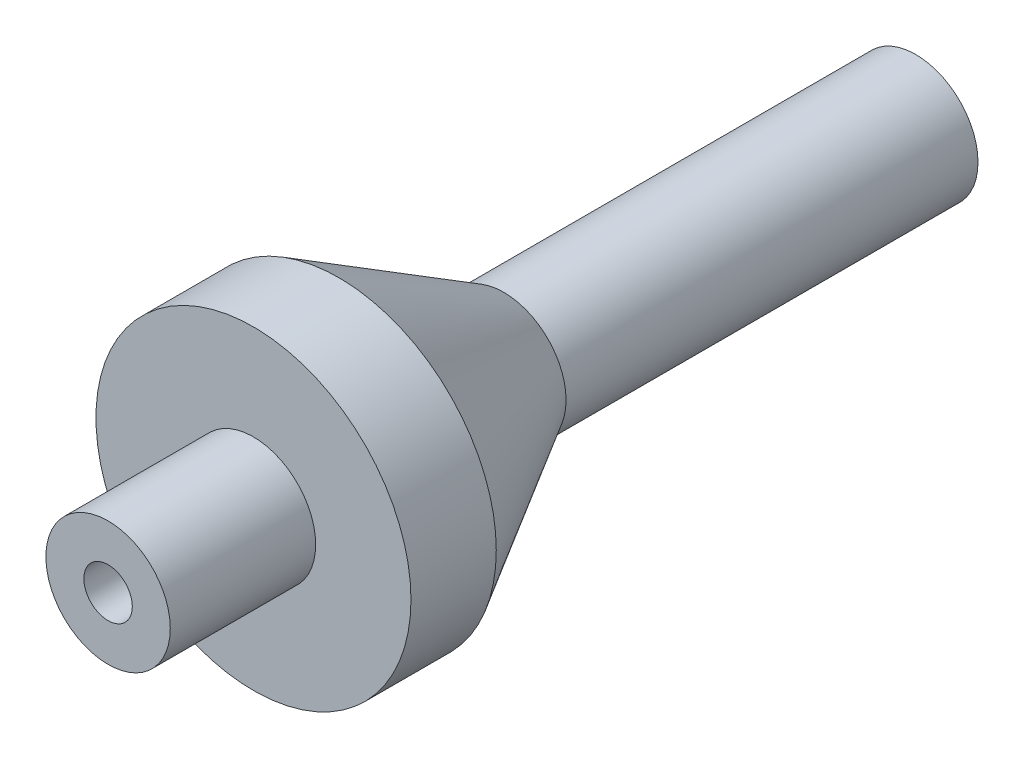
from build123d import *

# Parameters (mm, degrees)
CHAMFER1_SIZE   = 6.062177826
CHAMFER1_SIZE_2 = 10.5


with BuildPart() as part:
    # Sketch2 → Revolve1 (revolve)
    with BuildSketch(Plane(origin=(0, 0, 0), x_dir=(1, 0, 0), z_dir=(0, 1, 0))):
        Polygon((1.5, 0), (3.85, 0), (3.85, 9), (9.75, 9), (9.75, 14), (3.85, 14), (3.85, 50), (1.5, 50), align=None)
    revolve(axis=Axis((0, 0, 0), (0, 0, -1)))

    # Chamfer1
    # the kernel refuses this chamfer: 10.5, 6.062177826 mm, written as the material it adds along each edge
    with BuildSketch(Plane(origin=(0, 0, -14), x_dir=(1, 0, 0), z_dir=(0, 1, 0))) as chamfer1_piece_1_section:
        Polygon((3.85 + CHAMFER1_SIZE, 0), (3.85, CHAMFER1_SIZE_2), (3.85, 0), align=None)
    chamfer1_piece_1 = revolve(axis=Axis((0, 0, -14), (0, 0, -1)), mode=Mode.PRIVATE)
    chamfer1_piece_1 = chamfer1_piece_1 & Plane(origin=(0, 0, -19.51769374), x_dir=(1, 0, 0), z_dir=(0, 0, -1)) * Cylinder(9.75, 42, mode=Mode.PRIVATE)
    add(chamfer1_piece_1)


solid = part.part
